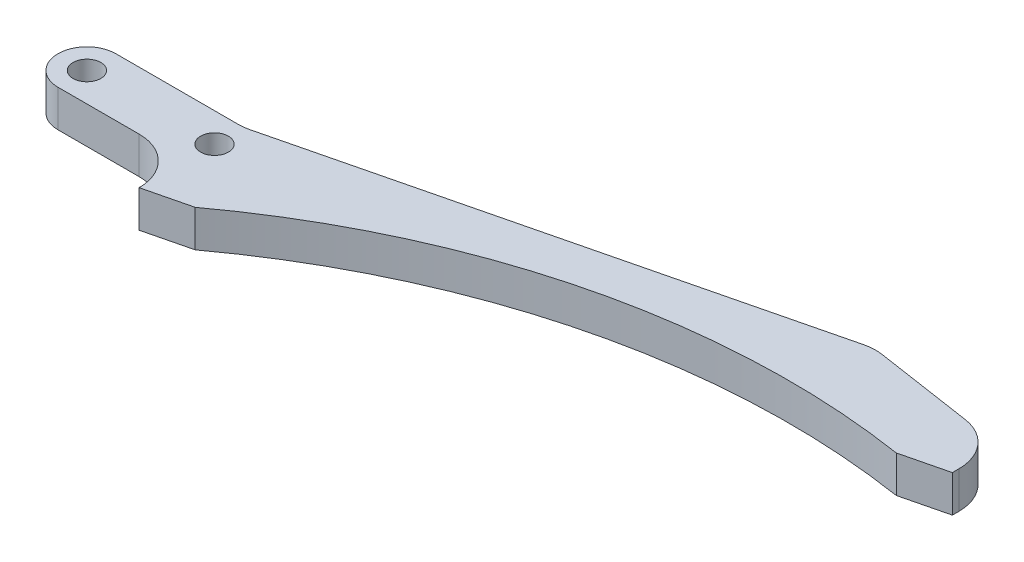
from build123d import *

# Parameters (mm, degrees)
SKETCH_1_W          = 32
SKETCH_1_H          = 10
SKETCH_1_R          = 2.395
EXTRUDE_2_DEPTH     = 6.36
FILLET_4_R          = 5
EXTRUDE_3_DEPTH     = 6.36
FILLET_5_R          = 8
FILLET_6_R          = 8
SKETCH_3_R          = 130
CUT_EXTRUDE_2_DEPTH = 6.36


with BuildPart() as part:
    # 草图1 → 凸台-拉伸2 (new body)
    with BuildSketch(Plane(origin=(0, 0, 0), x_dir=(1, 0, 0), z_dir=(0, 1, 0))):
        Rectangle(SKETCH_1_W, SKETCH_1_H)
        with Locations(Location((11, 0, 0), (0, 0, 90))):
            Circle(SKETCH_1_R, mode=Mode.SUBTRACT)
        with Locations(Location((-11, 0, 0), (0, 0, 90))):
            Circle(SKETCH_1_R, mode=Mode.SUBTRACT)
    extrude(amount=EXTRUDE_2_DEPTH)

    # 圆角4
    fillet_4_edges = [part.edges().sort_by_distance(p)[0] for p in [
        (-16, 3.18, 5),
        (-16, 3.18, -5),
    ]]
    fillet(fillet_4_edges, radius=FILLET_4_R - 0.0001)  # a hair under: the kernel refuses the full size

    # 草图2 → 凸台-拉伸3 (add)
    with BuildSketch(Plane(origin=(0, 0, 0), x_dir=(1, 0, 0), z_dir=(0, 1, 0))):
        Polygon((11, 5), (98.421265934, 26.389770044), (123.676298315, 22.569036945), (123.676298315, 14.569036945), (115.905519121, 12.667724053), (18.770779194, -11.098687107), (11, -13), (11, -5), (16, 0), align=None)
    extrude(amount=EXTRUDE_3_DEPTH)

    # 圆角5
    fillet_5_edges = [part.edges().sort_by_distance(p)[0] for p in [
        (123.676298315, 3.18, -22.569036945),
        (11, 3.18, 5),
    ]]
    fillet(fillet_5_edges, radius=FILLET_5_R - 0.0001)  # a hair under: the kernel refuses the full size

    # 圆角6
    fillet_6_edges = [part.edges().sort_by_distance(p)[0] for p in [
        (11, 3.18, -5),
        (98.421265934, 3.18, -26.389770044),
    ]]
    fillet(fillet_6_edges, radius=FILLET_6_R)

    # 草图3 → 切除-拉伸2 (cut)
    with BuildSketch(Plane(origin=(0, 0, 0), x_dir=(1, 0, 0), z_dir=(0, 1, 0))):
        with Locations((95.857842549, -115.777169439)):
            Circle(SKETCH_3_R)
    extrude(amount=CUT_EXTRUDE_2_DEPTH, mode=Mode.SUBTRACT)


solid = part.part
